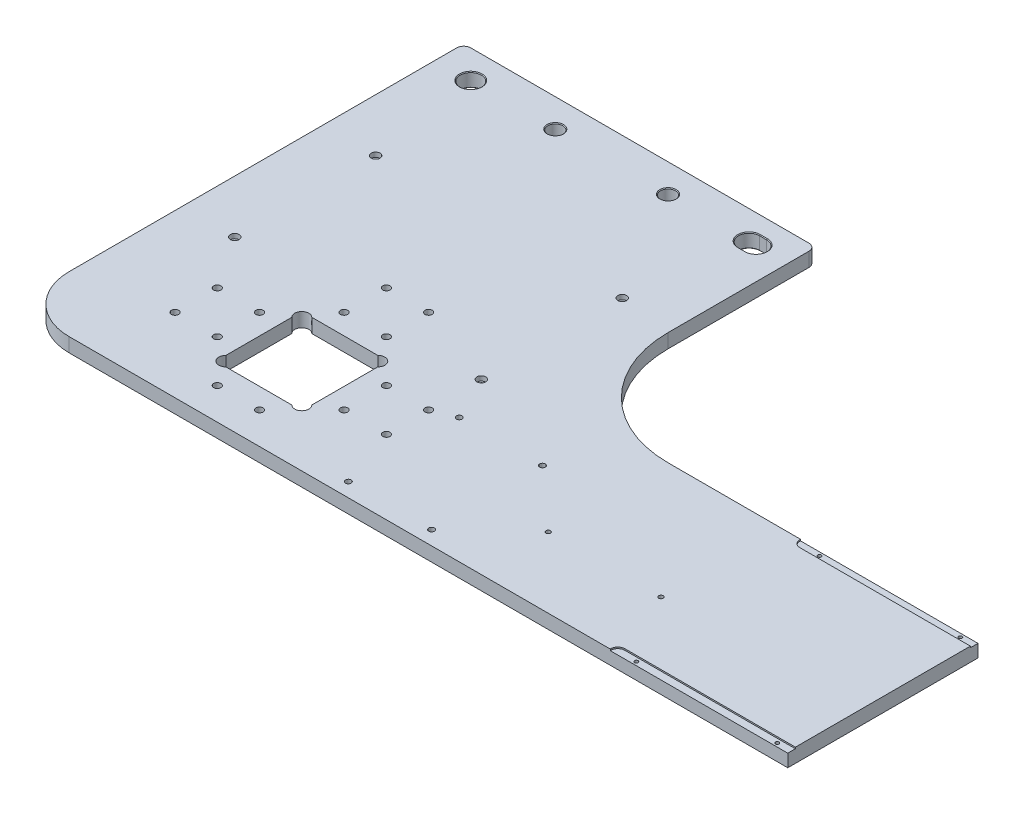
from build123d import *

# Parameters (mm, degrees)
SKETCH1_W                                      = 317.5
SKETCH1_H                                      = 406.4
BOSS_EXTRUDE1_DEPTH                            = 12.7
FILLET1_R                                      = 6.35
F_3_4_START                                    = 123.825
F_3_4_0_7500_DOWEL_SLOT1_3_DEPTH               = 6.35
F_1_2_CLEARANCE_HOLE1_D                        = 13.49248
F_1_2_CLEARANCE_HOLE1_CSINK_D                  = 14.76248
F_1_2_CLEARANCE_HOLE1_CSINK_ANGLE              = 90
SKETCH8_W                                      = 381
SKETCH8_H                                      = 171.45
BOSS_EXTRUDE2_DEPTH                            = 12.7
FILLET2_R                                      = 50.8
FILLET3_R                                      = 101.6
F_1_8_0_1250_DOWEL_HOLE1_D                     = 3.175
F_1_8_0_1250_DOWEL_HOLE1_CSINK_D               = 4.445
F_1_8_0_1250_DOWEL_HOLE1_CSINK_ANGLE           = 90
CUT_EXTRUDE1_DEPTH                             = 577.872249723
F_5_16_18_TAPPED_HOLE1_D                       = 6.5278
F_5_16_18_TAPPED_HOLE1_DEPTH                   = 20.1168
F_5_16_18_TAPPED_HOLE1_TIP                     = 1.961148974
CBORE_FOR_8_SOCKET_HEAD_CAP_SCREW1_D           = 4.4958
CBORE_FOR_8_SOCKET_HEAD_CAP_SCREW1_CBORE_D     = 7.9375
CBORE_FOR_8_SOCKET_HEAD_CAP_SCREW1_CBORE_DEPTH = 4.1656
SKETCH23_W                                     = 160.02
SKETCH23_H                                     = 6.858
CUT_EXTRUDE3_DEPTH                             = 1.27
FILLET4_R                                      = 6.35
F_10_32_TAPPED_HOLE1_D                         = 4.0386
F_1_4_20_TAPPED_HOLE1_D                        = 5.1054


with BuildPart() as part:
    # Sketch1 → Boss-Extrude1 (new body)
    with BuildSketch(Plane(origin=(0, 0, 0), x_dir=(1, 0, 0), z_dir=(0, 1, 0))):
        Rectangle(SKETCH1_W, SKETCH1_H)
    extrude(amount=BOSS_EXTRUDE1_DEPTH)

    # Fillet1
    fillet1_edges = [part.edges().sort_by_distance(p)[0] for p in [
        (-158.75, 6.35, -203.2),
        (158.75, 6.35, -203.2),
    ]]
    fillet(fillet1_edges, radius=FILLET1_R)

    # Sketch3 → 3/4 (0.7500) Dowel Hole1 (revolve, cut)
    with BuildSketch(Plane(origin=(-127, 12.7, -177.8), x_dir=(0, 0, 1), z_dir=(1, 0, 0))):
        Polygon((0, 0), (0, 12.7), (10.16, 12.7), (9.525, 12.065), (9.525, 0.635), (10.16, 0), align=None)
    revolve(axis=Axis((-127, 19.05, -177.8), (0, -1, 0)), mode=Mode.SUBTRACT)

    # 3/4 (0.7500) Dowel Slot1: read off the stored shape, not the designer's step
    # 3/4 (0.7500) Dowel Slot1 outline → 3/4 (0.7500) Dowel Slot1 (revolve, cut)
    with BuildSketch(Plane(origin=(130.175, 0, -177.8), x_dir=(1, 0, 0), z_dir=(0, 0, 1))):
        Polygon((0, 0), (10.16, 0), (9.525, 0.635), (9.525, 12.065), (10.16, 12.7), (0, 12.7), align=None)
    revolve(axis=Axis((130.175, 0, -177.8), (0, 1, 0)), mode=Mode.SUBTRACT)

    # 3_4 _0.7500_ Dowel Slot1 2 outline → 3_4 _0.7500_ Dowel Slot1 2 (revolve, cut)
    with BuildSketch(Plane(origin=(123.825, 0, -177.8), x_dir=(1, 0, 0), z_dir=(0, 0, 1))):
        Polygon((0, 0), (10.16, 0), (9.525, 0.635), (9.525, 12.065), (10.16, 12.7), (0, 12.7), align=None)
    revolve(axis=Axis((123.825, 0, -177.8), (0, 1, 0)), mode=Mode.SUBTRACT)

    # 3_4 _0.7500_ Dowel Slot1 3 outline → 3_4 _0.7500_ Dowel Slot1 3 (cut)
    with BuildSketch(Plane.YZ.offset(F_3_4_START)):
        Polygon((0.635, -187.325), (12.065, -187.325), (12.7, -187.96), (12.7, -167.64), (12.065, -168.275), (0.635, -168.275), (0, -167.64), (0, -187.96), align=None)
    extrude(amount=F_3_4_0_7500_DOWEL_SLOT1_3_DEPTH, mode=Mode.SUBTRACT)

    # 1/2 Clearance Hole1 (through all)
    with Locations(Plane(origin=(0, 12.7, 0), x_dir=(1, 0, 0), z_dir=(0, 1, 0))):
        with Locations((-50.8, 177.8), (50.8, 177.8)):
            CounterSinkHole(F_1_2_CLEARANCE_HOLE1_D / 2, F_1_2_CLEARANCE_HOLE1_CSINK_D / 2, counter_sink_angle=F_1_2_CLEARANCE_HOLE1_CSINK_ANGLE)

    # Sketch8 → Boss-Extrude2 (add)
    with BuildSketch(Plane(origin=(0, 0, 0), x_dir=(1, 0, 0), z_dir=(0, 1, 0))):
        with Locations((349.25, -117.475)):
            Rectangle(SKETCH8_W, SKETCH8_H)
    extrude(amount=BOSS_EXTRUDE2_DEPTH)

    # Fillet2
    fillet2_edges = [part.edges().sort_by_distance(p)[0] for p in [
        (-158.75, 6.35, 203.2),
    ]]
    fillet(fillet2_edges, radius=FILLET2_R)

    # Fillet3
    fillet3_edges = [part.edges().sort_by_distance(p)[0] for p in [
        (158.75, 6.35, 31.75),
    ]]
    fillet(fillet3_edges, radius=FILLET3_R)

    # 1/8 (0.1250) Dowel Hole1 (through all)
    with Locations(Plane(origin=(0, 12.7, 0), x_dir=(1, 0, 0), z_dir=(0, 1, 0))):
        with Locations((400.05, -34.925), (527.05, -34.925), (400.05, -200.025), (527.05, -200.025)):
            CounterSinkHole(F_1_8_0_1250_DOWEL_HOLE1_D / 2, F_1_8_0_1250_DOWEL_HOLE1_CSINK_D / 2, counter_sink_angle=F_1_8_0_1250_DOWEL_HOLE1_CSINK_ANGLE)

    # Sketch13 → Cut-Extrude1 (cut, through all)
    with BuildSketch(Plane(origin=(0, 12.7, 0), x_dir=(1, 0, 0), z_dir=(0, 1, 0))):
        with BuildLine():
            Line((-13.752743879, -156.21), (45.756743879, -156.21))
            ThreePointArc((45.756743879, -156.21), (54.737, -156.21), (54.737, -147.229743879))
            Line((54.737, -147.229743879), (54.737, -87.720256121))
            ThreePointArc((54.737, -87.720256121), (54.737, -78.74), (45.756743879, -78.74))
            Line((45.756743879, -78.74), (-13.752743879, -78.74))
            ThreePointArc((-13.752743879, -78.74), (-22.733, -78.74), (-22.733, -87.720256121))
            Line((-22.733, -87.720256121), (-22.733, -147.229743879))
            ThreePointArc((-22.733, -147.229743879), (-22.733, -156.21), (-13.752743879, -156.21))
        make_face()
    extrude(amount=-CUT_EXTRUDE1_DEPTH, mode=Mode.SUBTRACT)

    # 5/16-18 Tapped Hole1
    with Locations(Plane(origin=(0, 12.7, 0), x_dir=(1, 0, 0), z_dir=(0, 1, 0))):
        with Locations((-41.148, -98.425), (-41.148, -136.525), (73.152, -98.425), (73.152, -136.525), (-79.248, -98.425), (-79.248, -136.525), (111.252, -98.425), (111.252, -136.525), (-3.048, -60.325), (35.052, -60.325), (-3.048, -22.225), (35.052, -22.225), (-3.048, -174.625), (35.052, -174.625)):
            Hole(F_5_16_18_TAPPED_HOLE1_D / 2, depth=F_5_16_18_TAPPED_HOLE1_DEPTH)
            with Locations((0, 0, -(F_5_16_18_TAPPED_HOLE1_DEPTH + F_5_16_18_TAPPED_HOLE1_TIP / 2))):  # 118° drill point
                Cone(0, F_5_16_18_TAPPED_HOLE1_D / 2, F_5_16_18_TAPPED_HOLE1_TIP, mode=Mode.SUBTRACT)

    # CBORE for #8 Socket Head Cap Screw1 (through all)
    with Locations(Plane(origin=(0, 12.7, 0), x_dir=(1, 0, 0), z_dir=(0, 1, 0))):
        with Locations((-111.125, 76.2), (-111.125, -50.8), (111.125, 76.2), (111.125, -50.8)):
            CounterBoreHole(CBORE_FOR_8_SOCKET_HEAD_CAP_SCREW1_D / 2, CBORE_FOR_8_SOCKET_HEAD_CAP_SCREW1_CBORE_D / 2, CBORE_FOR_8_SOCKET_HEAD_CAP_SCREW1_CBORE_DEPTH)

    # Sketch23 → Cut-Extrude3 (cut)
    with BuildSketch(Plane(origin=(0, 12.7, 0), x_dir=(1, 0, 0), z_dir=(0, 1, 0))):
        with Locations((459.74, -35.179)):
            Rectangle(SKETCH23_W, SKETCH23_H)
        with Locations((459.74, -199.771)):
            Rectangle(SKETCH23_W, SKETCH23_H)
    extrude(amount=-CUT_EXTRUDE3_DEPTH, mode=Mode.SUBTRACT)

    # Fillet4
    fillet4_edges = [part.edges().sort_by_distance(p)[0] for p in [
        (379.73, 12.065, 38.608),
        (379.73, 12.065, 196.342),
    ]]
    fillet(fillet4_edges, radius=FILLET4_R)

    # #10-32 Tapped Hole1 (through all)
    with Locations(Plane(origin=(0, 12.7, 0), x_dir=(1, 0, 0), z_dir=(0, 1, 0))):
        with Locations((260.35, -139.7), (361.95, -139.7)):
            Hole(F_10_32_TAPPED_HOLE1_D / 2)

    # 1/4-20 Tapped Hole1 (through all)
    with Locations(Plane(origin=(0, 12.7, 0), x_dir=(1, 0, 0), z_dir=(0, 1, 0))):
        with Locations((130.937, -90.5), (205.937, -90.5), (205.937, -190.5), (130.937, -190.5)):
            Hole(F_1_4_20_TAPPED_HOLE1_D / 2)


solid = part.part
